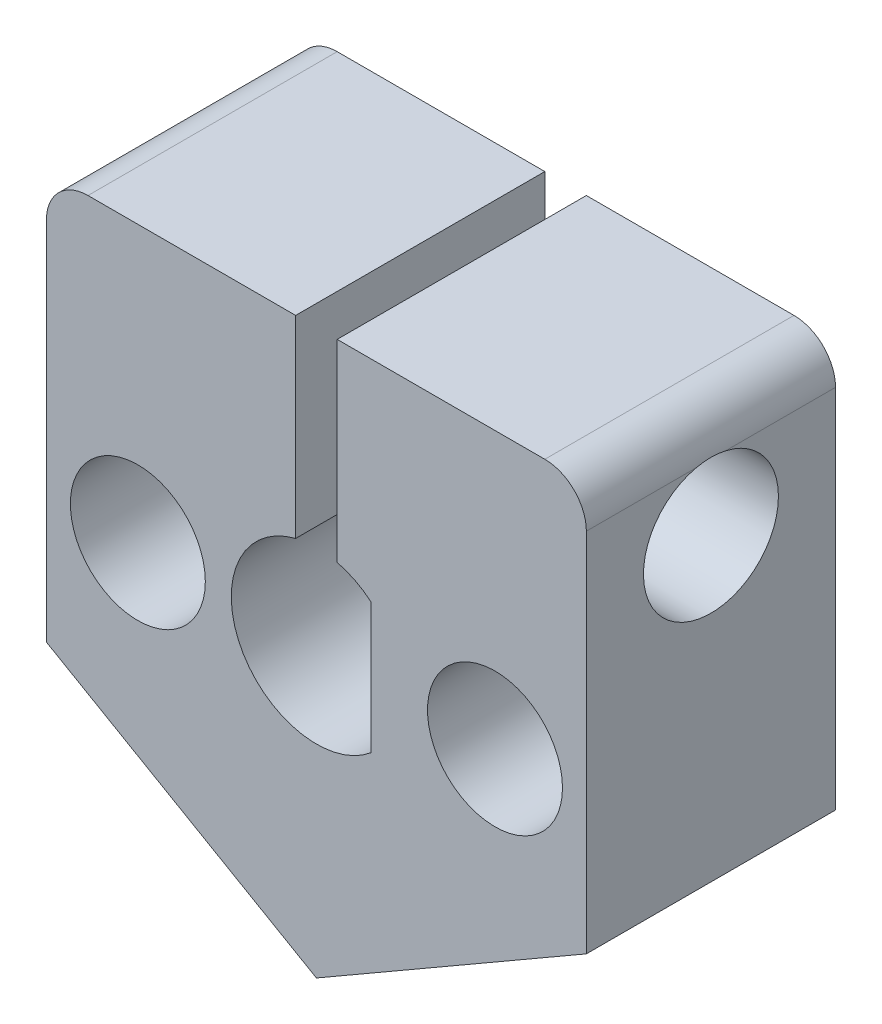
from build123d import *

# Parameters (mm, degrees)
BOSS_EXTRUDE1_DEPTH            = 12
SKETCH41_R                     = 1.7
CUT_EXTRUDE7_DEPTH             = 18
CBORE_FOR_M3_SHCS1_D           = 3.4
CBORE_FOR_M3_SHCS1_CBORE_D     = 6.5
CBORE_FOR_M3_SHCS1_CBORE_DEPTH = 3
F_3DSKETCH3_START              = 9
F_3DSKETCH3_OUTLINE_R          = 3.25
F_3DSKETCH3_OUTLINE_R_2        = 1.7
F_3DSKETCH3_DEPTH              = 3
CUT_EXTRUDE10_DEPTH            = 15
CUT_EXTRUDE10_DEPTH_BACK       = 15
SKETCH52_R                     = 1.7
SKETCH58_R                     = 3.25
CUT_EXTRUDE11_DEPTH            = 8
CUT_EXTRUDE12_DEPTH            = 4
CUT_EXTRUDE12_DEPTH_BACK       = 6
FILLET1_R                      = 2
SKETCH61_R                     = 3.25
CUT_EXTRUDE13_DEPTH            = 6
CUT_EXTRUDE14_DEPTH            = 1


# Read off the part's stored shape, not the designer's step: 3DSketch3
with BuildPart() as part:
    # Sketch1 → Boss-Extrude1 (new body)
    with BuildSketch(Plane(origin=(0, 0, 0), x_dir=(0, 1, 0), z_dir=(0, 0, 1))):
        with BuildLine():
            Line((-6.350852961, -13), (13.279056191, -13))
            Line((13.279056191, -13), (13.279056191, -1))
            Line((13.279056191, -1), (3.97617907, -1))
            ThreePointArc((3.97617907, -1), (3.650947901, -1.865631106), (3.14, -2.636361129))
            Line((3.14, -2.636361129), (-3.14, -2.636361129))
            ThreePointArc((-3.14, -2.636361129), (-3.852531635, -1.402854233), (-4.1, 0))
            ThreePointArc((-4.1, 0), (-0.503818326, 4.06892702), (3.97617907, 1))
            Line((3.97617907, 1), (13.279056191, 1))
            Line((13.279056191, 1), (13.279056191, 13))
            Line((13.279056191, 13), (-6.350852961, 13))
            Line((-6.350852961, 13), (-13.856406461, 0))
            Line((-13.856406461, 0), (-6.350852961, -13))
        make_face()
    extrude(amount=BOSS_EXTRUDE1_DEPTH)

    # Sketch41 → Cut-Extrude7 (cut)
    with BuildSketch(Plane(origin=(0, 0, 0), x_dir=(0, 1, 0), z_dir=(0, 0, 1))):
        with Locations(Location((0, 8.6, 0), (0, 0, 270))):
            Circle(SKETCH41_R)
        with Locations(Location((0, -8.6, 0), (0, 0, 270))):
            Circle(SKETCH41_R)
    extrude(amount=CUT_EXTRUDE7_DEPTH, mode=Mode.SUBTRACT)

    # CBORE for M3 SHCS1 (through all)
    with Locations(Plane(origin=(-8.6, 0, 12), x_dir=(1, 0, 0), z_dir=(0, 0, 1))):
        with Locations((0, 0)):
            CounterBoreHole(CBORE_FOR_M3_SHCS1_D / 2, CBORE_FOR_M3_SHCS1_CBORE_D / 2, CBORE_FOR_M3_SHCS1_CBORE_DEPTH)

    # 3DSketch3 outline → 3DSketch3 (cut)
    with BuildSketch(Plane.XY.offset(F_3DSKETCH3_START)):
        with Locations((8.6, 0)):
            Circle(F_3DSKETCH3_OUTLINE_R)
        with Locations((8.6, 0)):
            Circle(F_3DSKETCH3_OUTLINE_R_2, mode=Mode.SUBTRACT)
    extrude(amount=F_3DSKETCH3_DEPTH, mode=Mode.SUBTRACT)

    # Sketch52 → Cut-Extrude10 (cut, two sides: drawn at the far end of the back side and taken through both)
    with BuildSketch(Plane.YZ.offset(-1).offset(-CUT_EXTRUDE10_DEPTH_BACK)):
        with Locations((8.106406461, 6)):
            Circle(SKETCH52_R)
    extrude(amount=CUT_EXTRUDE10_DEPTH + CUT_EXTRUDE10_DEPTH_BACK, mode=Mode.SUBTRACT)

    # Sketch58 → Cut-Extrude11 (cut)
    with BuildSketch(Plane.YZ.offset(13)):
        with Locations(Location((8.106406461, 6, 0), (0, 0, 270))):
            Circle(SKETCH58_R)
    extrude(amount=-CUT_EXTRUDE11_DEPTH, mode=Mode.SUBTRACT)

    # Sketch60 → Cut-Extrude12 (cut, two sides: drawn at the far end of the back side and taken through both)
    with BuildSketch(Plane.YZ.offset(-8).offset(-CUT_EXTRUDE12_DEPTH_BACK)):
        Polygon((8.106406461, 2.709103466), (10.956406461, 4.354551733), (10.956406461, 7.645448267), (8.106406461, 9.290896534), (5.256406461, 7.645448267), (5.256406461, 4.354551733), align=None)
    extrude(amount=CUT_EXTRUDE12_DEPTH + CUT_EXTRUDE12_DEPTH_BACK, mode=Mode.SUBTRACT)

    # Fillet1
    # the kernel refuses this fillet: 2 mm, written as the material it takes off along each edge
    with BuildSketch(Plane(origin=(13, 13.279056191, -5), x_dir=(0, -1, 0), z_dir=(0, 0, 1)), Plane(origin=(-13, 13.279056191, -5), x_dir=(1, 0, 0), z_dir=(0, 0, 1))) as fillet1_piece_1:
        with BuildLine():
            CenterArc((FILLET1_R, -FILLET1_R), FILLET1_R, 90, 90)
            Line((0, -FILLET1_R), (0, 0))
            Line((0, 0), (FILLET1_R, 0))
        make_face()
    extrude(amount=22, mode=Mode.SUBTRACT)

    # Sketch61 → Cut-Extrude13 (cut)
    with BuildSketch(Plane(origin=(0, 0, 12), x_dir=(0, 1, 0), z_dir=(0, 0, 1))):
        with Locations(Location((0, 8.6, 0), (0, 0, 270))):
            Circle(SKETCH61_R)
        with Locations(Location((0, -8.6, 0), (0, 0, 270))):
            Circle(SKETCH61_R)
    extrude(amount=-CUT_EXTRUDE13_DEPTH, mode=Mode.SUBTRACT)

    # Sketch62 → Cut-Extrude14 (cut)
    with BuildSketch(Plane(origin=(-6, -10.392304845, 0), x_dir=(-0.8660254037844386, 0.5000000000000001, 0), z_dir=(-0.5000000000000001, -0.8660254037844386, 0))):
        Polygon((0.424736725, -2.743282535), (1.346010764, -2.743282535), (1.346010764, -6.243282535), (0.897292815, -6.243282535), (0.897292815, -3.102256894), (0.134472302, -3.102256894), align=None)
    extrude(amount=-CUT_EXTRUDE14_DEPTH, mode=Mode.SUBTRACT)


solid = part.part
